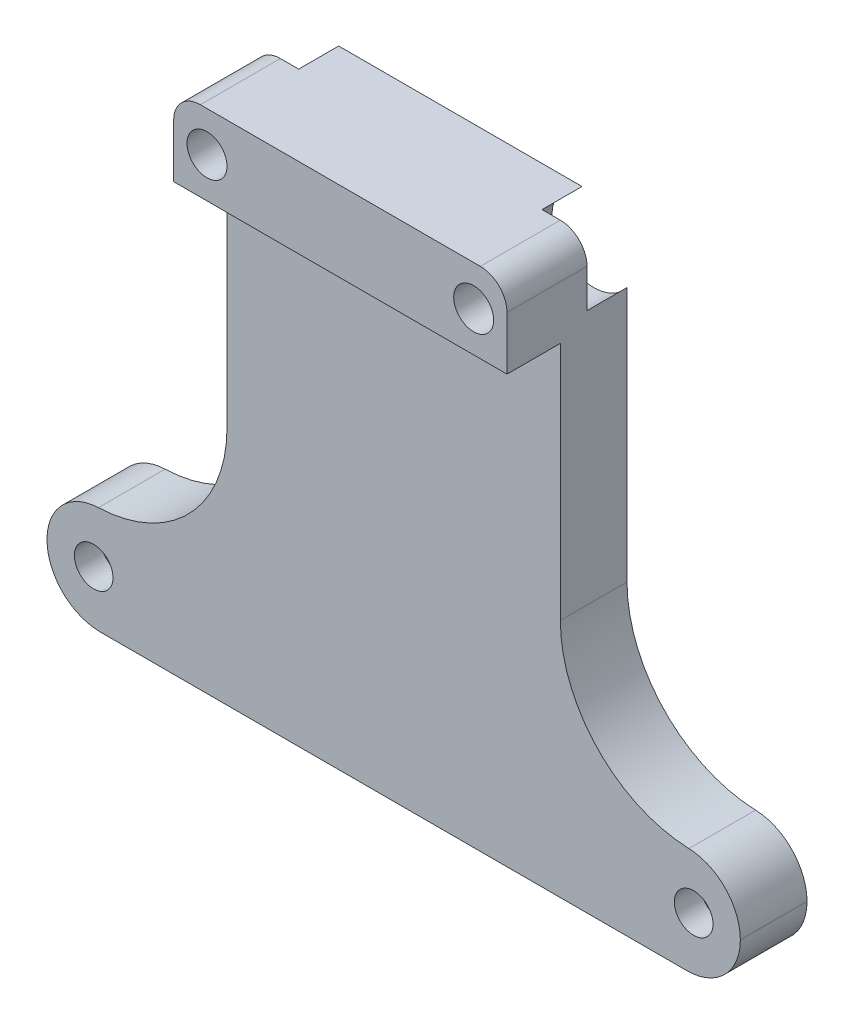
from build123d import *

# Parameters (mm, degrees)
SKETCH_1_W          = 52
SKETCH_1_H          = 8
SKETCH_1_R          = 1.45
EXTRUDE_1_DEPTH     = 5
SKETCH_2_W          = 25
SKETCH_2_H          = 34
SKETCH_2_R          = 1.5
EXTRUDE_2_DEPTH     = 5
SKETCH_3_W          = 25
SKETCH_3_H          = 6
SKETCH_3_R          = 1.5
EXTRUDE_3_DEPTH     = 4
FILLET_1_R          = 10
FILLET_2_R          = 4
FILLET_3_R          = 2
SKETCH_4_R          = 3.125
CUT_EXTRUDE_3_DEPTH = 3


with BuildPart() as part:
    # Эскиз1 → Бобышка-Вытянуть1 (new body)
    with BuildSketch(Plane.XY):
        Rectangle(SKETCH_1_W, SKETCH_1_H)
        with Locations((-22.5, 0)):
            Circle(SKETCH_1_R, mode=Mode.SUBTRACT)
        with Locations((22.5, 0)):
            Circle(SKETCH_1_R, mode=Mode.SUBTRACT)
    extrude(amount=EXTRUDE_1_DEPTH)

    # Эскиз2 → Бобышка-Вытянуть2 (add)
    with BuildSketch(Plane(origin=(0, 0, 0), x_dir=(-1, 0, 0), z_dir=(0, 0, -1))):
        with Locations((0, 21)):
            Rectangle(SKETCH_2_W, SKETCH_2_H)
        with Locations((-10, 35)):
            Circle(SKETCH_2_R, mode=Mode.SUBTRACT)
        with Locations((10, 35)):
            Circle(SKETCH_2_R, mode=Mode.SUBTRACT)
    extrude(amount=-EXTRUDE_2_DEPTH)

    # Эскиз3 → Бобышка-Вытянуть3 (add)
    with BuildSketch(Plane(origin=(0, 0, 5), x_dir=(-1, 0, 0), z_dir=(0, 0, -1))):
        with Locations((0, 35)):
            Rectangle(SKETCH_3_W, SKETCH_3_H)
        with Locations((10, 35)):
            Circle(SKETCH_3_R, mode=Mode.SUBTRACT)
        with Locations((-10, 35)):
            Circle(SKETCH_3_R, mode=Mode.SUBTRACT)
    extrude(amount=-EXTRUDE_3_DEPTH)

    # Скругление1
    fillet_1_edges = [part.edges().sort_by_distance(p)[0] for p in [
        (12.5, 4, 2.5),
        (-12.5, 4, 2.5),
    ]]
    fillet(fillet_1_edges, radius=FILLET_1_R)

    # Скругление2
    fillet_2_edges = [part.edges().sort_by_distance(p)[0] for p in [
        (-26, -4, 2.5),
        (-26, 4, 2.5),
        (26, -4, 2.5),
        (26, 4, 2.5),
    ]]
    fillet(fillet_2_edges, radius=FILLET_2_R)

    # Скругление3
    fillet_3_edges = [part.edges().sort_by_distance(p)[0] for p in [
        (12.5, 38, 4.5),
        (-12.5, 38, 4.5),
    ]]
    fillet(fillet_3_edges, radius=FILLET_3_R)

    # Эскиз4 → Вырез-Вытянуть3 (cut)
    with BuildSketch(Plane(origin=(0, 0, 0), x_dir=(-1, 0, 0), z_dir=(0, 0, -1))):
        with Locations((-10, 35)):
            Circle(SKETCH_4_R)
        with Locations((10, 35)):
            Circle(SKETCH_4_R)
        with Locations((-22.5, 0)):
            Circle(SKETCH_4_R)
        with Locations((22.5, 0)):
            Circle(SKETCH_4_R)
    extrude(amount=-CUT_EXTRUDE_3_DEPTH, mode=Mode.SUBTRACT)


solid = part.part
